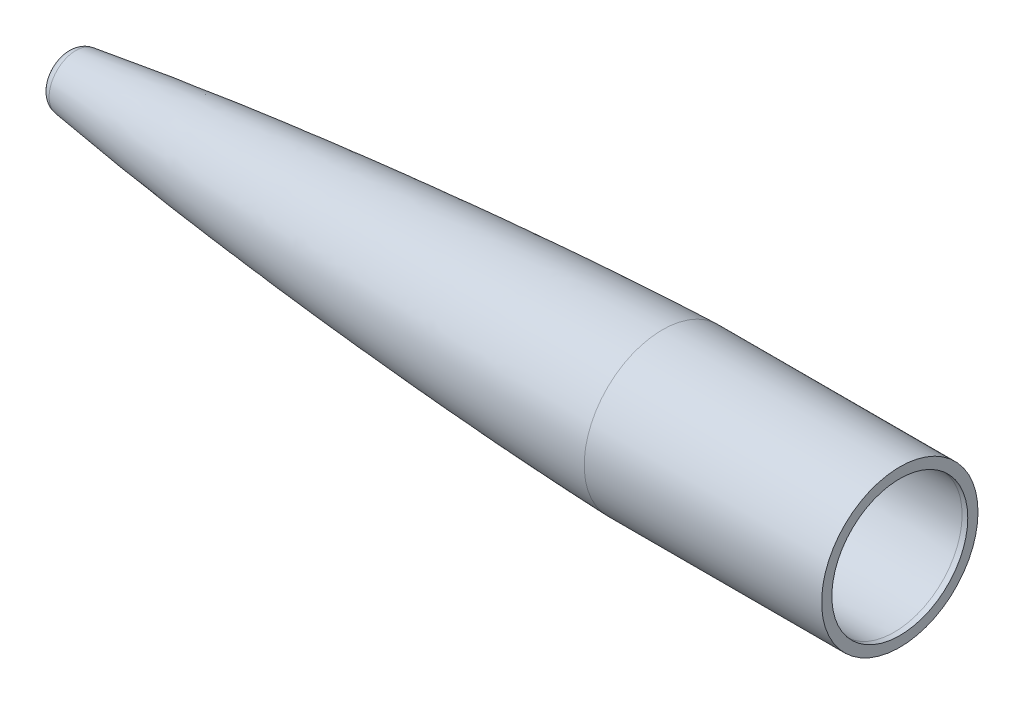
from build123d import *


with BuildPart() as part:
    # Sketch1 → Revolve1 (revolve)
    with BuildSketch(Plane.XY):
        with BuildLine():
            Line((6.35, 11.460570284), (-259.812483715, 11.460570284))
            add(Edge.make_bspline(
                [(-259.812483715, 11.460570284), (-287.31210638, 10.562340852), (-342.298022137, 8.171569009), (-452.140135716, 1.833524736), (-589.280273052, -8.512118808), (-726.176632388, -21.770900754), (-835.465785428, -34.58872614), (-890.027026607, -41.965202762), (-917.245364413, -46.039623622)],
                knots=[0.121539178, 0.121539178, 0.121539178, 0.121539178, 0.200323508, 0.279107838, 0.436676499, 0.594245159, 0.67302949, 0.75181382, 0.75181382, 0.75181382, 0.75181382], degree=3))
            ThreePointArc((-917.245364413, -46.039623622), (-924.987260279, -50.310773033), (-928.0652, -58.599678629))
            Line((-928.0652, -58.599678629), (-921.7152, -58.599678629))
            ThreePointArc((-921.7152, -58.599678629), (-920.17623014, -54.455225831), (-916.305282206, -52.319651125))
            add(Edge.make_bspline(
                [(-259.605182082, 5.113954963), (-267.127682546, 4.868244998), (-283.42603151, 4.285669281), (-317.270262329, 2.880505646), (-361.130016616, 0.711244662), (-431.275457269, -3.371956494), (-501.372917975, -8.266876273), (-571.414486843, -13.891682648), (-623.914744737, -18.477698889), (-676.380314027, -23.439349795), (-728.80566324, -28.799062072), (-772.453634614, -33.627485173), (-807.34181653, -37.739154543), (-833.490683911, -40.958900147), (-859.619375692, -44.328941115), (-885.723877265, -47.869335132), (-904.612492975, -50.577906922), (-914.800968172, -52.094464395), (-916.305282206, -52.319651125)],
                knots=[0.121539178, 0.121539178, 0.121539178, 0.121539178, 0.143122913, 0.168303261, 0.218663957, 0.269024652, 0.369746043, 0.420106738, 0.470467434, 0.520828129, 0.571188825, 0.62154952, 0.646729868, 0.671910216, 0.697090564, 0.722270911, 0.747451259, 0.75181382, 0.75181382, 0.75181382, 0.75181382], degree=3))
            ThreePointArc((-259.605182082, 5.113954963), (-256.399753184, 4.364993874), (-254, 2.11179575))
            ThreePointArc((-254, 2.11179575), (-251.60858665, -0.136927523), (-248.413737762, -0.890953221))
            add(Edge.make_bspline(
                [(0, 0), (-50.8, 0), (-101.6, 0), (-157.182375328, 0), (-166.747125983, 0), (-181.094251966, 0), (-190.659002621, 0), (-199.585120865, 0), (-207.872606698, 0), (-220.304800851, -0.154959839), (-228.589711976, -0.361524821), (-235.094659099, -0.523710542), (-239.819642219, -0.641517002), (-245.046645359, -0.791480258), (-247.911294959, -0.876040976), (-248.413737762, -0.890953221)],
                knots=[0.761574077, 0.761574077, 0.761574077, 0.761574077, 0.907841521, 0.907841521, 0.921611321, 0.935381121, 0.94915092, 0.94915092, 0.961081918, 0.973012916, 0.984943914, 0.984943914, 0.991748303, 0.998552693, 1, 1, 1, 1], degree=3))
            Line((0, 0), (6.35, 0))
            Line((6.35, 0), (6.35, 11.460570284))
        make_face()
    revolve(axis=Axis((0, -76.2, 0), (-1, 0, 0)))


solid = part.part
